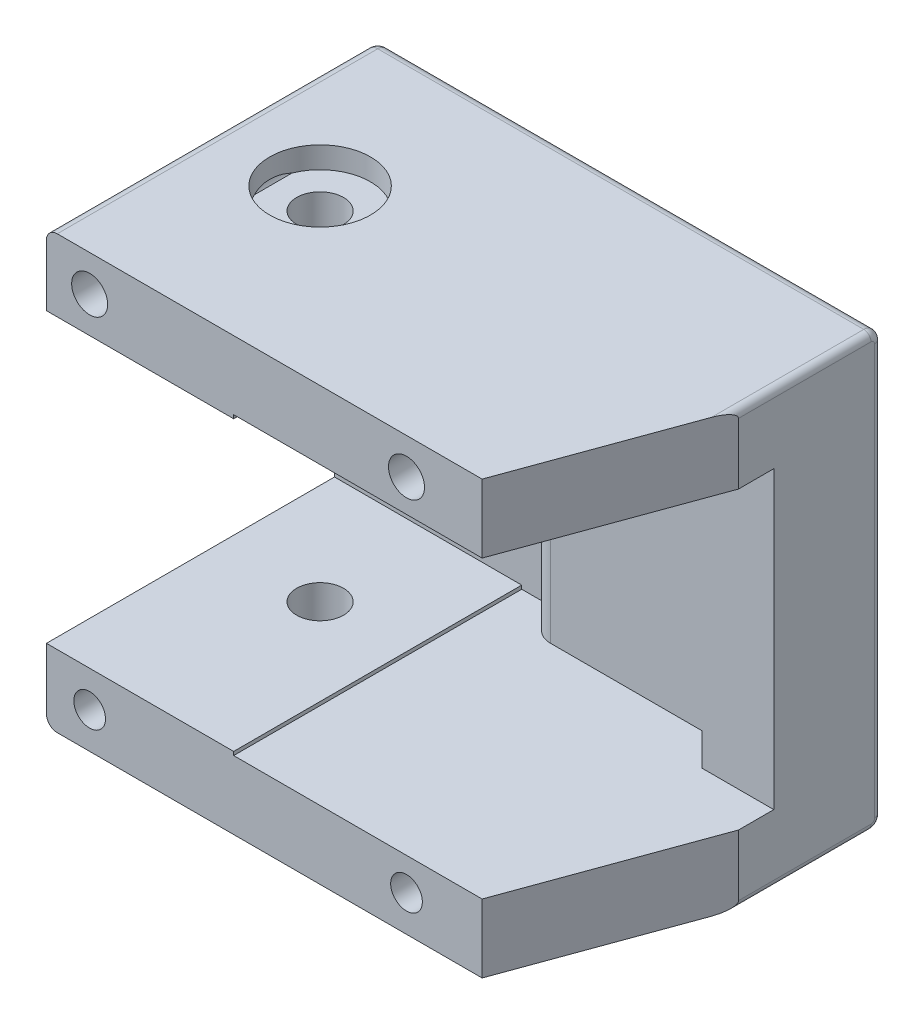
from build123d import *

# Parameters (mm, degrees)
SKETCH1_W              = 35
SKETCH1_H              = 20
BASE_PLATE_DEPTH       = 3
SKETCH2_W              = 35
SKETCH2_H              = 5
SIDE_WALLS_DEPTH       = 23
SKETCH4_R              = 1.1
SKETCH4_R_2            = 1.25
M2_SCREWS_DEPTH        = 23
SKETCH6_W              = 5
SKETCH6_H              = 20
RETURN_STOPPER_DEPTH   = 4.5
SKETCH9_W              = 12
SKETCH9_H              = 16
BOSS_EXTRUDE1_DEPTH    = 4.5
SKETCH7_R              = 7.75
MAGNET_POCKET_DEPTH    = 6
SKETCH8_R              = 2
M2_SCREW_HEAD_DEPTH    = 1.5
M3_ACHSLE_DEPTH        = 39.213217609
M3_ACHSLE_DEPTH_BACK   = 39.213217609
SKETCH5_R              = 1.625
SKETCH14_R             = 3.5
CUT_EXTRUDE1_DEPTH     = 1.5
CUT_EXTRUDE2_START     = -1.5
SKETCH15_R             = 3.5
CUT_EXTRUDE2_DEPTH     = 1.5
FILLET1_R              = 1.5
LEAVER_START           = -0.25
SKETCH11_W             = 22
SKETCH11_H             = 15.5
LEAVER_SPACE_DEPTH     = 20.5
SKETCH12_W             = 17
SKETCH12_H             = 4.5
MORE_SPACE_LEFT_DEPTH  = 0.25
SKETCH13_W             = 17
SKETCH13_H             = 4.5
MORE_SPACE_RIGHT_DEPTH = 0.25
FILLET2_R              = 0.75
FILLET3_R              = 0.75
FILLET4_R              = 0.75
FILLET5_R              = 0.5
CHAMFER1_SIZE          = 13.050517742
CHAMFER1_SIZE_2        = 4.75


with BuildPart() as part:
    # Sketch1 → Base Plate (new body)
    with BuildSketch(Plane.XY):
        Rectangle(SKETCH1_W, SKETCH1_H)
    extrude(amount=BASE_PLATE_DEPTH)

    # Sketch2 → Side Walls (add)
    with BuildSketch(Plane(origin=(0, 0, 0), x_dir=(1, 0, 0), z_dir=(0, 0, -1))):
        with Locations((0, -12.5)):
            Rectangle(SKETCH2_W, SKETCH2_H)
        with Locations((0, 12.5)):
            Rectangle(SKETCH2_W, SKETCH2_H)
    extrude(amount=-SIDE_WALLS_DEPTH)

    # Sketch4 → M2 Screws (cut)
    with BuildSketch(Plane.XY.offset(23)):
        with Locations((-14.5, -12.5)):
            Circle(SKETCH4_R)
        with Locations((7.5, -12.5)):
            Circle(SKETCH4_R)
        with Locations((7.5, 12.5)):
            Circle(SKETCH4_R_2)
        with Locations((-14.5, 12.5)):
            Circle(SKETCH4_R_2)
    extrude(amount=-M2_SCREWS_DEPTH, mode=Mode.SUBTRACT)

    # Sketch6 → Return Stopper (add)
    with BuildSketch(Plane.XY.offset(3)):
        with Locations((15, 0)):
            Rectangle(SKETCH6_W, SKETCH6_H)
    extrude(amount=RETURN_STOPPER_DEPTH)

    # Sketch9 → Boss-Extrude1 (add)
    with BuildSketch(Plane.XY.offset(3)):
        with Locations((6.5, 0)):
            Rectangle(SKETCH9_W, SKETCH9_H)
    extrude(amount=BOSS_EXTRUDE1_DEPTH)

    # Sketch7 → Magnet Pocket (cut)
    with BuildSketch(Plane(origin=(0, 0, 0), x_dir=(-1, 0, 0), z_dir=(0, 0, 1))):
        with Locations(Location((-8.75, 0, 0), (0, 0, 90))):
            Circle(SKETCH7_R)
    extrude(amount=MAGNET_POCKET_DEPTH, mode=Mode.SUBTRACT)

    # Sketch8 → M2 Screw Head (cut)
    with BuildSketch(Plane(origin=(0, 0, 0), x_dir=(1, 0, 0), z_dir=(0, 0, -1))):
        with Locations(Location((7.5, -12.5, 0), (0, 0, 270))):
            Circle(SKETCH8_R)
        with Locations(Location((-14.5, -12.5, 0), (0, 0, 270))):
            Circle(SKETCH8_R)
        with Locations(Location((7.5, 12.5, 0), (0, 0, 270))):
            Circle(SKETCH8_R)
        with Locations(Location((-14.5, 12.5, 0), (0, 0, 270))):
            Circle(SKETCH8_R)
    extrude(amount=-M2_SCREW_HEAD_DEPTH, mode=Mode.SUBTRACT)

    # Sketch5 → M3 Achsle (cut, two sides: drawn at the far end of the back side and taken through both)
    with BuildSketch(Plane.XZ.offset(-10).offset(-M3_ACHSLE_DEPTH_BACK)):
        with Locations((-10.5, 11)):
            Circle(SKETCH5_R)
    extrude(amount=M3_ACHSLE_DEPTH + M3_ACHSLE_DEPTH_BACK, mode=Mode.SUBTRACT)

    # Sketch14 → Cut-Extrude1 (cut)
    with BuildSketch(Plane(origin=(0, 15, 0), x_dir=(-1, 0, 0), z_dir=(0, 1, 0))):
        with Locations((10.5, 11)):
            Circle(SKETCH14_R)
    extrude(amount=-CUT_EXTRUDE1_DEPTH, mode=Mode.SUBTRACT)

    # Sketch15 → Cut-Extrude2 (cut)
    with BuildSketch(Plane.XZ.offset(15).offset(CUT_EXTRUDE2_START)):
        with Locations(Location((-10.5, 11, 0), (0, 0, 180))):
            Circle(SKETCH15_R)
    extrude(amount=CUT_EXTRUDE2_DEPTH, mode=Mode.SUBTRACT)

    # Fillet1
    fillet1_edges = [part.edges().sort_by_distance(p)[0] for p in [
        (0.5, 0, 7.5),
    ]]
    fillet(fillet1_edges, radius=FILLET1_R)

    # Sketch11 → Leaver Space (cut)
    with BuildSketch(Plane.XZ.offset(-10).offset(LEAVER_START)):
        with Locations((6.5, 15.25)):
            Rectangle(SKETCH11_W, SKETCH11_H)
    extrude(amount=LEAVER_SPACE_DEPTH, mode=Mode.SUBTRACT)

    # Sketch12 → More Space left (cut)
    with BuildSketch(Plane.XZ.offset(-10)):
        with Locations((4, 5.25)):
            Rectangle(SKETCH12_W, SKETCH12_H)
    extrude(amount=-MORE_SPACE_LEFT_DEPTH, mode=Mode.SUBTRACT)

    # Sketch13 → More Space right (cut)
    with BuildSketch(Plane(origin=(0, -10, 0), x_dir=(-1, 0, 0), z_dir=(0, 1, 0))):
        with Locations((-4, 5.25)):
            Rectangle(SKETCH13_W, SKETCH13_H)
    extrude(amount=-MORE_SPACE_RIGHT_DEPTH, mode=Mode.SUBTRACT)

    # Fillet2
    # the kernel refuses this fillet: 0.75 mm, written as the material it takes off along each edge
    with BuildSketch(Plane(origin=(19.375, 15, 0), x_dir=(0, -1, 0), z_dir=(-1, 0, 0))) as fillet2_piece_1:
        with BuildLine():
            CenterArc((FILLET2_R, FILLET2_R), FILLET2_R, 180, 90)
            Line((0, FILLET2_R), (0, 0))
            Line((0, 0), (FILLET2_R, 0))
        make_face()
    extrude(amount=38.75, mode=Mode.SUBTRACT)

    # Fillet3
    # the kernel refuses this fillet: 0.75 mm, written as the material it takes off along each edge
    with BuildSketch(Plane(origin=(-19.375, -15, 0), x_dir=(0, 1, 0), z_dir=(1, 0, 0))) as fillet3_piece_1:
        with BuildLine():
            CenterArc((FILLET3_R, FILLET3_R), FILLET3_R, 180, 90)
            Line((0, FILLET3_R), (0, 0))
            Line((0, 0), (FILLET3_R, 0))
        make_face()
    extrude(amount=38.75, mode=Mode.SUBTRACT)

    # Fillet4
    fillet4_edges = [part.edges().sort_by_distance(p)[0] for p in [
        (-17.5, -15, 11.875),
        (-17.5, 0, 0),
        (-17.5, 14.780330086, 0.219669914),
        (-17.5, -14.780330086, 0.219669914),
        (-17.5, 15, 11.875),
    ]]
    fillet(fillet4_edges, radius=FILLET4_R)

    # Fillet5
    fillet5_edges = [part.edges().sort_by_distance(p)[0] for p in [
        (17.5, -15, 11.875),
        (17.5, 14.780330086, 0.219669914),
        (17.5, 0, 0),
        (17.5, -14.780330086, 0.219669914),
        (17.5, 15, 11.875),
    ]]
    fillet(fillet5_edges, radius=FILLET5_R)

    # Chamfer1
    # the kernel refuses this chamfer: 13.050517742, 4.75 mm, written as the material it takes off along each edge
    with BuildSketch(Plane(origin=(17.5, -48.355584384, 23), x_dir=(0.013184058198645798, 0, -0.9999130865277316), z_dir=(0, 1, 0))) as chamfer1_piece_1:
        Polygon((CHAMFER1_SIZE * 0.999913086559, CHAMFER1_SIZE * 0.0131840581991), (-CHAMFER1_SIZE_2 * 0.0131840581986, CHAMFER1_SIZE_2 * 0.999913086528), (0, 0), align=None)
    extrude(amount=71.961168769, mode=Mode.SUBTRACT)
    with BuildSketch(Plane(origin=(17.5, -23.605584384, 23), x_dir=(-0.9950833631817486, 0, 0.09904090225205059), z_dir=(0, 1, 0))) as chamfer1_piece_2:
        Polygon((CHAMFER1_SIZE_2 * 0.995083363182, -CHAMFER1_SIZE_2 * 0.0990409022521), (-CHAMFER1_SIZE * 0.0990409022552, -CHAMFER1_SIZE * 0.995083363213), (0, 0), align=None)
    extrude(amount=71.961168769, mode=Mode.SUBTRACT)


solid = part.part
